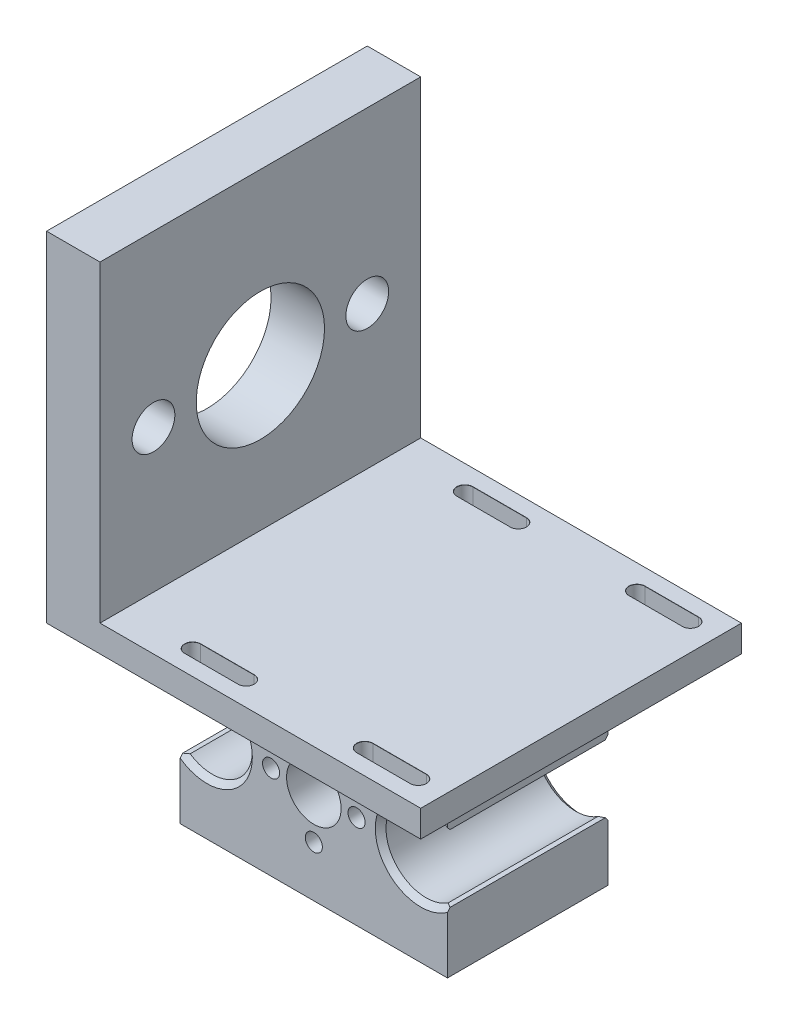
from build123d import *

# Parameters (mm, degrees)
SKETCH_1_W               = 50
SKETCH_1_H               = 35
EXTRUDE_1_DEPTH          = 30
HOLE_WIZARD_363_D        = 8.5
HOLE_WIZARD_468_D        = 3.2
HOLE_WIZARD_622_D        = 15
CHAMFER_1_SIZE           = 1
CHAMFER_1_SIZE_2         = 0.708203932
SKETCH_8_W               = 70
SKETCH_8_H               = 60
SKETCH_8_W_2             = 50
SKETCH_8_H_2             = 30
EXTRUDE_2_DEPTH          = 63.5
HOLE_WIZARD_1_D          = 24
HOLE_WIZARD_2_D          = 8
CHAMFER_2_SIZE           = 0.25
CUT_EXTRUDE_2_DEPTH      = 107.705201373
CUT_EXTRUDE_2_DEPTH_BACK = 107.705201373
SKETCH_14_W              = 60
SKETCH_14_H              = 58.5
MM_START                 = 17
MM_2_DEPTH               = 5.5
RIB_1_REACH              = 95.199
SKETCH_25_WALL_W         = 201.46144539
SKETCH_25_WALL_H         = 30
RIB_2_REACH              = 101.05
SKETCH_26_WALL_W         = 216.17250262
SKETCH_26_WALL_H         = 15
RIB_4_REACH              = 108.5
SKETCH_27_WALL_W         = 231.071518272
SKETCH_27_WALL_H         = 7
HOLE_WIZARD_3_D          = 10.2
HOLE_WIZARD_3_DEPTH      = 10.2


with BuildPart() as part:
    # 草图1 → 凸台-拉伸1 (new body)
    with BuildSketch(Plane.XY):
        Rectangle(SKETCH_1_W, SKETCH_1_H)
    extrude(amount=EXTRUDE_1_DEPTH)

    # Hole Wizard 363 (through all)
    with Locations(Plane.XY.offset(30)):
        with Locations((0, 0)):
            Hole(HOLE_WIZARD_363_D / 2)

    # Hole Wizard 468 (through all)
    with Locations(Plane.XY.offset(30)):
        with Locations((8, 0), (0, 8), (-8, 0), (0, -8)):
            Hole(HOLE_WIZARD_468_D / 2)

    # Hole Wizard 622 (through all)
    with Locations(Plane.XY.offset(30)):
        with Locations((20, 0), (-20, 0)):
            Hole(HOLE_WIZARD_622_D / 2)

    # 倒角1
    # the kernel refuses this chamfer: 1, 0.708203932 mm, written as the material it takes off along each edge
    with BuildSketch(Plane(origin=(-20, 0, 0), x_dir=(-0.8790200859122482, 0.4767847402789059, 0), z_dir=(-0.4767847402789059, -0.8790200859122482, 0))) as chamfer_1_piece_1:
        Polygon((7.5, -CHAMFER_1_SIZE), (7.5 + CHAMFER_1_SIZE, 0), (7.5, 0), align=None)
    revolve(axis=Axis((-20, 0, 0), (0, 0, -1)), revolution_arc=303.048763938, mode=Mode.SUBTRACT)
    with BuildSketch(Plane(origin=(-20, 0, 30), x_dir=(-0.879020085912248, 0.47678474027890627, 0), z_dir=(-0.47678474027890627, -0.879020085912248, 0))) as chamfer_1_piece_2:
        Polygon((7.5 + CHAMFER_1_SIZE, 0), (7.5, CHAMFER_1_SIZE), (7.5, 0), align=None)
    revolve(axis=Axis((-20, 0, 30), (0, 0, -1)), revolution_arc=303.048763938, mode=Mode.SUBTRACT)
    with BuildSketch(Plane(origin=(20, 0, 30), x_dir=(0.879020085912248, -0.4767847402789061, 0), z_dir=(0.4767847402789061, 0.879020085912248, 0))) as chamfer_1_piece_3:
        Polygon((7.5 + CHAMFER_1_SIZE, 0), (7.5, CHAMFER_1_SIZE), (7.5, 0), align=None)
    revolve(axis=Axis((20, 0, 30), (0, 0, -1)), revolution_arc=303.048763938, mode=Mode.SUBTRACT)
    with BuildSketch(Plane(origin=(20, 0, 0), x_dir=(0.8790200859122481, 0.476784740278906, 0), z_dir=(0.476784740278906, -0.8790200859122481, 0))) as chamfer_1_piece_4:
        Polygon((7.5, CHAMFER_1_SIZE), (7.5 + CHAMFER_1_SIZE, 0), (7.5, 0), align=None)
    revolve(axis=Axis((20, 0, 0), (0, 0, 1)), revolution_arc=303.048763938, mode=Mode.SUBTRACT)
    with BuildSketch(Plane(origin=(-25, 5.590169944, 32.778051389), x_dir=(0.7914486393779661, 0.611235675682274, 0), z_dir=(0, 0, -1)), Plane(origin=(25, -5.590169944, 32.778051389), x_dir=(-0.7914486393779661, -0.611235675682274, 0), z_dir=(0, 0, -1))) as chamfer_1_piece_5:
        with BuildLine():
            Line((1.080663788, 0), (CHAMFER_1_SIZE_2 * 0.611235676113, -CHAMFER_1_SIZE_2 * 0.791448639936))
            Line((CHAMFER_1_SIZE_2 * 0.611235676113, -CHAMFER_1_SIZE_2 * 0.791448639936), (0, 0))
            ThreePointArc((0, 0), (0.555522087, -0.019473843), (1.080663788, 0))
        make_face()
    extrude(amount=35.556102778, mode=Mode.SUBTRACT)
    with BuildSketch(Plane(origin=(-25, -5.590169944, 32.778051389), x_dir=(0.7914486393779665, -0.6112356756822735, 0), z_dir=(0, 0, -1))) as chamfer_1_piece_6:
        with BuildLine():
            Line((1.080663788, 0), (CHAMFER_1_SIZE_2 * 0.611235676113, CHAMFER_1_SIZE_2 * 0.791448639936))
            Line((CHAMFER_1_SIZE_2 * 0.611235676113, CHAMFER_1_SIZE_2 * 0.791448639936), (0, 0))
            ThreePointArc((0, 0), (0.555522087, 0.019473843), (1.080663788, 0))
        make_face()
    extrude(amount=35.556102778, mode=Mode.SUBTRACT)
    with BuildSketch(Plane(origin=(25, 5.590169944, 32.778051389), x_dir=(0, 1, 0), z_dir=(0, 0, -1))) as chamfer_1_piece_7:
        with BuildLine():
            Line((CHAMFER_1_SIZE_2, 0), (0.660540261, -0.855289885))
            ThreePointArc((0.660540261, -0.855289885), (0.354967464, -0.427764092), (0, 0))
            Line((0, 0), (CHAMFER_1_SIZE_2, 0))
        make_face()
    extrude(amount=35.556102778, mode=Mode.SUBTRACT)

    # 草图8 → 凸台-拉伸2 (add)
    # profile 1 of 5: a face of its own
    with BuildSketch(Plane(origin=(0, 17.5, 0), x_dir=(1, 0, 0), z_dir=(0, 1, 0))):
        with Locations((0, -15)):
            Rectangle(SKETCH_8_W, SKETCH_8_H)
        with Locations((0, -15)):
            Rectangle(SKETCH_8_W_2, SKETCH_8_H_2, mode=Mode.SUBTRACT)
    # profile 2 of 5: a face of its own
    with BuildSketch(Plane(origin=(0, 17.5, 0), x_dir=(1, 0, 0), z_dir=(0, 1, 0))):
        Polygon((25, 0), (0, -15), (25, -30), align=None)
    # profile 3 of 5: a face of its own
    with BuildSketch(Plane(origin=(0, 17.5, 0), x_dir=(1, 0, 0), z_dir=(0, 1, 0))):
        Polygon((25, -30), (0, -15), (-25, -30), align=None)
    # profile 4 of 5: a face of its own
    with BuildSketch(Plane(origin=(0, 17.5, 0), x_dir=(1, 0, 0), z_dir=(0, 1, 0))):
        Polygon((0, -15), (-25, 0), (-25, -30), align=None)
    # profile 5 of 5: a face of its own
    with BuildSketch(Plane(origin=(0, 17.5, 0), x_dir=(1, 0, 0), z_dir=(0, 1, 0))):
        Polygon((25, 0), (-25, 0), (0, -15), align=None)
    extrude(amount=EXTRUDE_2_DEPTH)

    # 孔1 (through all)
    with Locations(Plane(origin=(35, 0, 0), x_dir=(0, 0, -1), z_dir=(1, 0, 0))):
        with Locations((-15, 49.25)):
            Hole(HOLE_WIZARD_1_D / 2)

    # 孔2 (through all)
    with Locations(Plane(origin=(35, 0, 0), x_dir=(0, 0, -1), z_dir=(1, 0, 0))):
        with Locations((5, 49.25), (-35, 49.25)):
            Hole(HOLE_WIZARD_2_D / 2)

    # 倒角2
    chamfer_2_edges = [part.edges().sort_by_distance(p)[0] for p in [
        (-35, 49.25, 31),
        (-35, 49.25, -9),
    ]]
    chamfer(chamfer_2_edges, length=CHAMFER_2_SIZE)

    # 草图14 → 切除-拉伸2 (cut, two sides: drawn at the far end of the back side and taken through both)
    with BuildSketch(Plane.XY.offset(45).offset(-CUT_EXTRUDE_2_DEPTH_BACK)):
        with Locations((5, 51.75)):
            Rectangle(SKETCH_14_W, SKETCH_14_H)
    extrude(amount=CUT_EXTRUDE_2_DEPTH + CUT_EXTRUDE_2_DEPTH_BACK, mode=Mode.SUBTRACT)

    # 大小mm 暗销槽口2: read off the stored shape, not the designer's step
    # 大小mm 暗销槽口2 outline → 大小mm 暗销槽口2 (cut)
    with BuildSketch(Plane(origin=(0, 0, 0), x_dir=(1, 0, 0), z_dir=(0, 1, 0)).offset(MM_START)):
        with BuildLine():
            Line((30, 11.959259259), (20, 11.959259259))
            ThreePointArc((20, 11.959259259), (18.5, 10.459259259), (20, 8.959259259))
            Line((20, 8.959259259), (30, 8.959259259))
            ThreePointArc((30, 8.959259259), (31.5, 10.459259259), (30, 11.959259259))
        make_face()
        with BuildLine():
            ThreePointArc((-12.203065134, 11.959259259), (-13.703065134, 10.459259259), (-12.203065134, 8.959259259))
            Line((-12.203065134, 8.959259259), (-2.203065134, 8.959259259))
            ThreePointArc((-2.203065134, 8.959259259), (-0.703065134, 10.459259259), (-2.203065134, 11.959259259))
            Line((-2.203065134, 11.959259259), (-12.203065134, 11.959259259))
        make_face()
    mm_2 = extrude(amount=MM_2_DEPTH, mode=Mode.SUBTRACT)

    # mm _2 2: loft between two sections, ruled curve by curve
    mm_2_2_from = [
        Edge.make_three_point_arc((30, 22.475, -8.959259259), (31.060660172, 22.475, -9.398599087), (31.5, 22.475, -10.459259259)),
        Edge.make_three_point_arc((31.5, 22.475, -10.459259259), (31.060660172, 22.475, -11.519919431), (30, 22.475, -11.959259259)),
        Edge.make_three_point_arc((20, 22.475, -11.959259259), (18.939339828, 22.475, -11.519919431), (18.5, 22.475, -10.459259259)),
        Edge.make_three_point_arc((18.5, 22.475, -10.459259259), (18.939339828, 22.475, -9.398599087), (20, 22.475, -8.959259259)),
        Edge.make_line((30, 22.475, -11.959259259), (20, 22.475, -11.959259259)),
        Edge.make_line((30, 22.475, -8.959259259), (20, 22.475, -8.959259259)),
    ]
    mm_2_2_to = [
        Edge.make_three_point_arc((30, 22.5, -8.934259259), (31.078337841, 22.5, -9.380921418), (31.525, 22.5, -10.459259259)),
        Edge.make_three_point_arc((31.525, 22.5, -10.459259259), (31.078337841, 22.5, -11.537597101), (30, 22.5, -11.984259259)),
        Edge.make_three_point_arc((20, 22.5, -11.984259259), (18.921662159, 22.5, -11.537597101), (18.475, 22.5, -10.459259259)),
        Edge.make_three_point_arc((18.475, 22.5, -10.459259259), (18.921662159, 22.5, -9.380921418), (20, 22.5, -8.934259259)),
        Edge.make_line((30, 22.5, -11.984259259), (20, 22.5, -11.984259259)),
        Edge.make_line((30, 22.5, -8.934259259), (20, 22.5, -8.934259259)),
    ]
    mm_2_2 = Solid(Shell([*[Face.make_surface_from_curves(mm_2_2_from[k], mm_2_2_to[k]) for k in range(6)], Face(Wire(mm_2_2_from)), Face(Wire(mm_2_2_to))]))
    add(mm_2_2, mode=Mode.SUBTRACT)

    # mm _2 3: loft between two sections, ruled curve by curve
    mm_2_3_from = [
        Edge.make_three_point_arc((-2.203065134, 22.475, -8.959259259), (-1.142404962, 22.475, -9.398599087), (-0.703065134, 22.475, -10.459259259)),
        Edge.make_three_point_arc((-0.703065134, 22.475, -10.459259259), (-1.142404962, 22.475, -11.519919431), (-2.203065134, 22.475, -11.959259259)),
        Edge.make_three_point_arc((-12.203065134, 22.475, -11.959259259), (-13.263725306, 22.475, -11.519919431), (-13.703065134, 22.475, -10.459259259)),
        Edge.make_three_point_arc((-13.703065134, 22.475, -10.459259259), (-13.263725306, 22.475, -9.398599087), (-12.203065134, 22.475, -8.959259259)),
        Edge.make_line((-2.203065134, 22.475, -11.959259259), (-12.203065134, 22.475, -11.959259259)),
        Edge.make_line((-2.203065134, 22.475, -8.959259259), (-12.203065134, 22.475, -8.959259259)),
    ]
    mm_2_3_to = [
        Edge.make_three_point_arc((-2.203065134, 22.5, -8.934259259), (-1.124727293, 22.5, -9.380921418), (-0.678065134, 22.5, -10.459259259)),
        Edge.make_three_point_arc((-0.678065134, 22.5, -10.459259259), (-1.124727293, 22.5, -11.537597101), (-2.203065134, 22.5, -11.984259259)),
        Edge.make_three_point_arc((-12.203065134, 22.5, -11.984259259), (-13.281402975, 22.5, -11.537597101), (-13.728065134, 22.5, -10.459259259)),
        Edge.make_three_point_arc((-13.728065134, 22.5, -10.459259259), (-13.281402975, 22.5, -9.380921418), (-12.203065134, 22.5, -8.934259259)),
        Edge.make_line((-2.203065134, 22.5, -11.984259259), (-12.203065134, 22.5, -11.984259259)),
        Edge.make_line((-2.203065134, 22.5, -8.934259259), (-12.203065134, 22.5, -8.934259259)),
    ]
    mm_2_3 = Solid(Shell([*[Face.make_surface_from_curves(mm_2_3_from[k], mm_2_3_to[k]) for k in range(6)], Face(Wire(mm_2_3_from)), Face(Wire(mm_2_3_to))]))
    add(mm_2_3, mode=Mode.SUBTRACT)

    # 镜向1: 大小mm 暗销槽口2, mm _2 2, mm _2 3 across plane
    add(mm_2.mirror(Plane(origin=(0, 0, 15), x_dir=(1, 0, 0), z_dir=(0, 0, -1))), mode=Mode.SUBTRACT)
    add(mm_2_2.mirror(Plane(origin=(0, 0, 15), x_dir=(1, 0, 0), z_dir=(0, 0, -1))), mode=Mode.SUBTRACT)
    add(mm_2_3.mirror(Plane(origin=(0, 0, 15), x_dir=(1, 0, 0), z_dir=(0, 0, -1))), mode=Mode.SUBTRACT)

    # 草图25 wall → 筋1 (add, up to next)
    with BuildSketch(Plane(origin=(-30, 13.296768148, 15), x_dir=(-0.765461137236, 0.6434821267, 0), z_dir=(0.6434821267, 0.765461137236, 0)), mode=Mode.PRIVATE) as rib_1_sk1:
        Rectangle(SKETCH_25_WALL_W, SKETCH_25_WALL_H)
    rib_1_tool1 = extrude(rib_1_sk1.sketch, amount=RIB_1_REACH, mode=Mode.PRIVATE) - part.part
    rib_1 = rib_1_tool1.solids().sort_by_distance((-30, 13.296768148, 15))[0]
    add(rib_1)

    # 镜向2: 筋1 across plane
    add(rib_1.mirror(Plane(origin=(0, 0, 0), x_dir=(0, 0, 1), z_dir=(1, 0, 0))))

    # 草图26 wall → 筋2 (add, up to next)
    with BuildSketch(Plane(origin=(0, 14.614965359, 37.5), x_dir=(0, 0.359024529342, 0.933328124151), z_dir=(0, -0.933328124151, 0.359024529342)), mode=Mode.PRIVATE) as rib_2_sk1:
        with Locations((0, -7.5)):
            Rectangle(SKETCH_26_WALL_W, SKETCH_26_WALL_H)
    rib_2_tool1 = extrude(rib_2_sk1.sketch, amount=-RIB_2_REACH, mode=Mode.PRIVATE) - part.part
    rib_2 = rib_2_tool1.solids().sort_by_distance((0, 14.614965359, 37.5))[0]
    add(rib_2)

    # 草图27 wall → 筋4 (add, up to next)
    with BuildSketch(Plane(origin=(-17.5, 14.614965359, 37.5), x_dir=(0, -0.359024529342, -0.933328124151), z_dir=(0, 0.933328124151, -0.359024529342)), mode=Mode.PRIVATE) as rib_4_sk1:
        with Locations((0, 3.5)):
            Rectangle(SKETCH_27_WALL_W, SKETCH_27_WALL_H)
    rib_4_tool1 = extrude(rib_4_sk1.sketch, amount=RIB_4_REACH, mode=Mode.PRIVATE) - part.part
    rib_4 = rib_4_tool1.solids().sort_by_distance((-17.5, 14.614965359, 37.5))[0]
    add(rib_4)

    # 镜向4: 筋2, 筋4 across plane
    add(rib_2.mirror(Plane(origin=(0, 0, 15), x_dir=(1, 0, 0), z_dir=(0, 0, -1))))
    add(rib_4.mirror(Plane(origin=(0, 0, 15), x_dir=(1, 0, 0), z_dir=(0, 0, -1))))

    # 孔3
    with Locations(Plane.XY.offset(30)):
        with Locations((0, 0)):
            Hole(HOLE_WIZARD_3_D / 2, depth=HOLE_WIZARD_3_DEPTH)


solid = part.part
